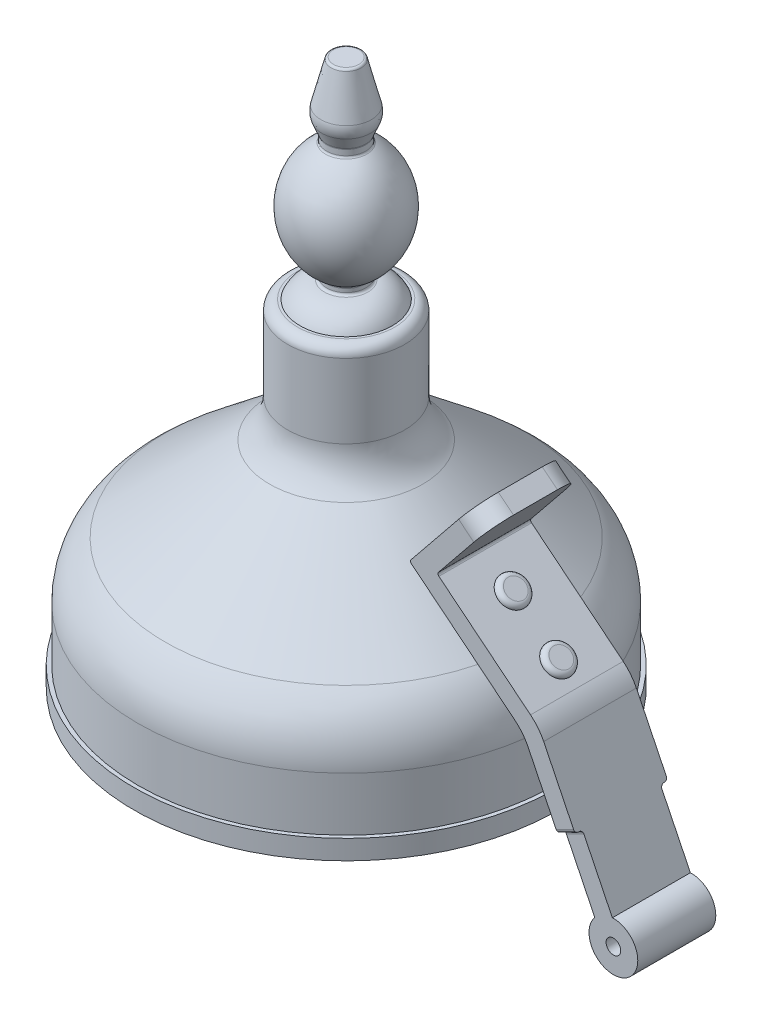
from build123d import *

# Parameters (mm, degrees)
SKETCH2_R           = 5
SKETCH2_R_2         = 1.5
BOSS_EXTRUDE1_DEPTH = 9.5
FILLET1_R           = 5
FILLET2_R           = 0.5
SKETCH3_R           = 3
BOSS_EXTRUDE2_DEPTH = 1
FILLET3_R           = 1
CUT_EXTRUDE1_START  = -92.878989
SKETCH4_W           = 1.5
SKETCH4_H           = 14
SKETCH4_H_2         = 9.582575695
CUT_EXTRUDE1_DEPTH  = 96.923378
FILLET4_R           = 0.7


with BuildPart() as part:
    # Sketch1 → Revolve1 (revolve)
    with BuildSketch(Plane.XY, mode=Mode.PRIVATE) as revolve1_sk:
        with BuildLine():
            Line((0, 0), (30, 0))
            Line((30, 0), (39, 8))
            Line((39, 8), (43.5, 8))
            Line((43.5, 8), (43.5, 12))
            Line((43.5, 12), (42.7, 12))
            Line((42.7, 12), (42.7, 23))
            ThreePointArc((42.7, 23), (41.237125486, 29.46113253), (37.133835524, 34.662021579))
            Line((37.133835524, 34.662021579), (15.710776317, 51.991917226))
            ThreePointArc((15.710776317, 51.991917226), (12.975249676, 55.459176591), (12, 59.766598278))
            Line((12, 59.766598278), (12, 74.950961509))
            ThreePointArc((12, 74.950961509), (11.4016958, 76.395395624), (9.957261685, 76.993699825))
            Line((9.957261685, 76.993699825), (9.457239337, 76.993699825))
            ThreePointArc((9.457239337, 76.993699825), (7.435175355, 79.419305874), (4.461538462, 80.482222183))
            ThreePointArc((4.461538462, 80.482222183), (4.133100307, 80.641057588), (4, 80.980740698))
            Line((4, 80.980740698), (4, 81.720781011))
            ThreePointArc((4, 81.720781011), (4.062228774, 81.962351608), (4.233425414, 82.143791637))
            ThreePointArc((4.233425414, 82.143791637), (10.5, 93.5), (4.233425414, 104.856208363))
            ThreePointArc((4.233425414, 104.856208363), (4.062228774, 105.037648392), (4, 105.279218989))
            Line((4, 105.279218989), (4, 106.402065454))
            ThreePointArc((4, 106.402065454), (4.00932374, 106.498173768), (4.036947232, 106.590697725))
            Line((4.036947232, 106.590697725), (5.00311013, 108.962425541))
            ThreePointArc((5.00311013, 108.962425541), (5.289238494, 110.196699028), (5.174989817, 111.458542013))
            Line((5.174989817, 111.458542013), (3.095901624, 119.623382288))
            ThreePointArc((3.095901624, 119.623382288), (2.91820983, 119.894772811), (2.611363894, 120))
            Line((2.611363894, 120), (0, 120))
            Line((0, 120), (0, 0))
        make_face()
    revolve(revolve1_sk.sketch.rotate(Axis((0, 0, 0), (0, 1, 0)), 90), axis=Axis((0, 0, 0), (0, 1, 0)))


with BuildPart() as body_2:
    # Sketch2 → Boss-Extrude1 (new, symmetric)
    # profile 1 of 2: a face of its own
    with BuildSketch(Plane.XY):
        with BuildLine():
            Line((35.707204121, 62.82683021), (22.499834387, 46.5))
            Line((22.499834387, 46.5), (44.100272251, 29.026616274))
            ThreePointArc((44.100272251, 29.026616274), (45.633941503, 27.481088144), (46.796743158, 25.64024842))
            Line((46.796743158, 25.64024842), (58.988817141, 0.675245181))
            ThreePointArc((58.988817141, 0.675245181), (60.6027772, 1.927992552), (62.583094977, 2.43057046))
            Line((62.583094977, 2.43057046), (50.001874748, 28.192405912))
            ThreePointArc((50.001874748, 28.192405912), (48.839073093, 30.033245636), (47.305403841, 31.578773766))
            Line((47.305403841, 31.578773766), (28.125396281, 47.094182948))
            Line((28.125396281, 47.094182948), (38.817076542, 60.311140737))
            Line((38.817076542, 60.311140737), (35.707204121, 62.82683021))
        make_face()
    # profile 2 of 2: a face of its own
    with BuildSketch(Plane.XY):
        with Locations((62.796933799, -2.564854743)):
            Circle(SKETCH2_R)
        with Locations((62.796933799, -2.564854743)):
            Circle(SKETCH2_R_2, mode=Mode.SUBTRACT)
    extrude(amount=BOSS_EXTRUDE1_DEPTH, both=True)

    # Fillet1
    fillet1_edges = [body_2.edges().sort_by_distance(p)[0] for p in [
        (37.262140331, 61.568985473, -9.5),
        (37.262140331, 61.568985473, 9.5),
    ]]
    fillet(fillet1_edges, radius=FILLET1_R)

    # Fillet2
    fillet2_edges = [body_2.edges().sort_by_distance(p)[0] for p in [
        (22.499834387, 46.5, 0),
        (28.125396281, 47.094182948, 0),
    ]]
    fillet(fillet2_edges, radius=FILLET2_R)

    # Sketch3 → Boss-Extrude2 (add)
    with BuildSketch(Plane(origin=(34.15231855, 42.218785229, 0), x_dir=(0.7774681052383513, -0.6289223682912607, 0), z_dir=(0.6289223682912606, 0.7774681052383512, 0))):
        with Locations(Location((0, 0, 0), (0, 0, 180))):
            Circle(SKETCH3_R)
        with Locations(Location((12, 0, 0), (0, 0, 180))):
            Circle(SKETCH3_R)
    extrude(amount=BOSS_EXTRUDE2_DEPTH)

    # Fillet3
    fillet3_edges = [body_2.edges().sort_by_distance(p)[0] for p in [
        (37.113645234, 41.109486229, 0),
        (46.443262497, 33.56241781, 0),
    ]]
    fillet(fillet3_edges, radius=FILLET3_R - 0.0001)  # a hair under: the kernel refuses the full size

    # Sketch4 → Cut-Extrude1 (cut)
    with BuildSketch(Plane(origin=(51.489708745, 25.145854472, 0), x_dir=(0, 0, -1), z_dir=(0.8985694590185689, 0.4388313198930499, 0)).offset(CUT_EXTRUDE1_START)):
        with Locations((-8.75, -18.279385788)):
            Rectangle(SKETCH4_W, SKETCH4_H)
        with Locations((8.75, -30.070673636)):
            Rectangle(SKETCH4_W, SKETCH4_H_2)
        with Locations((8.75, -18.279385788)):
            Rectangle(SKETCH4_W, SKETCH4_H)
        with Locations((-8.75, -30.070673636)):
            Rectangle(SKETCH4_W, SKETCH4_H_2)
    extrude(amount=CUT_EXTRUDE1_DEPTH, mode=Mode.SUBTRACT)

    # Fillet4
    fillet4_edges = [body_2.edges().sort_by_distance(p)[0] for p in [
        (54.64231758, 14.132880247, -9.5),
        (54.64231758, 14.132880247, -8),
        (54.64231758, 14.132880247, 8),
        (54.64231758, 14.132880247, 9.5),
    ]]
    fillet(fillet4_edges, radius=FILLET4_R)


solid = Compound([part.part, body_2.part])
